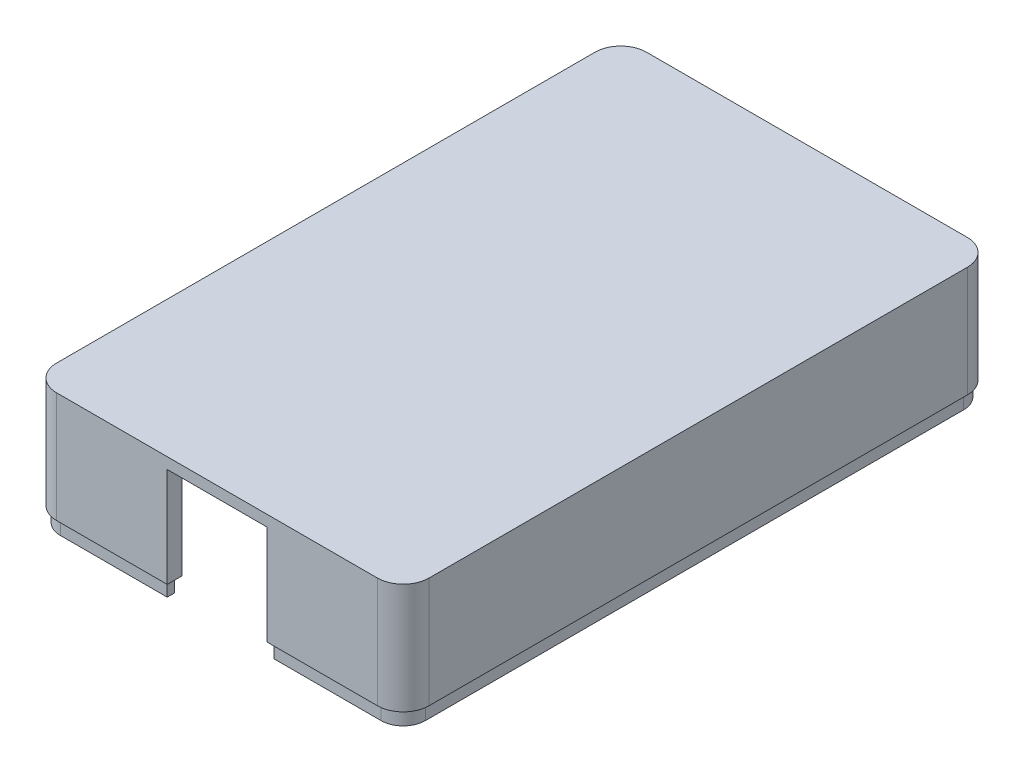
from build123d import *

# Parameters (mm, degrees)
BOSS_EXTRUDE1_DEPTH     = 15
CUT_EXTRUDE1_DEPTH      = 13.5
SKETCH3_W               = 13.5
SKETCH3_H               = 27
CUT_EXTRUDE2_DEPTH      = 15
SALIENTE_EXTRUIR1_DEPTH = 2


with BuildPart() as part:
    # Sketch1 → Boss-Extrude1 (new body)
    with BuildSketch(Plane(origin=(0, 0, 0), x_dir=(1, 0, 0), z_dir=(0, 1, 0))):
        with BuildLine():
            Line((-21.75, -40), (21.75, -40))
            ThreePointArc((21.75, -40), (24.224873734, -38.974873734), (25.25, -36.5))
            Line((25.25, -36.5), (25.25, 36.5))
            ThreePointArc((25.25, 36.5), (24.224873734, 38.974873734), (21.75, 40))
            Line((21.75, 40), (-21.75, 40))
            ThreePointArc((-21.75, 40), (-24.224873734, 38.974873734), (-25.25, 36.5))
            Line((-25.25, 36.5), (-25.25, -36.5))
            ThreePointArc((-25.25, -36.5), (-24.224873734, -38.974873734), (-21.75, -40))
        make_face()
    extrude(amount=BOSS_EXTRUDE1_DEPTH)

    # Sketch2 → Cut-Extrude1 (cut)
    with BuildSketch(Plane.XZ):
        with BuildLine():
            Line((-19.75, -38), (19.75, -38))
            ThreePointArc((19.75, -38), (22.224873734, -36.974873734), (23.25, -34.5))
            Line((23.25, -34.5), (23.25, 34.5))
            ThreePointArc((23.25, 34.5), (22.224873734, 36.974873734), (19.75, 38))
            Line((19.75, 38), (-19.75, 38))
            ThreePointArc((-19.75, 38), (-22.224873734, 36.974873734), (-23.25, 34.5))
            Line((-23.25, 34.5), (-23.25, -34.5))
            ThreePointArc((-23.25, -34.5), (-22.224873734, -36.974873734), (-19.75, -38))
        make_face()
    extrude(amount=-CUT_EXTRUDE1_DEPTH, mode=Mode.SUBTRACT)

    # Sketch3 → Cut-Extrude2 (cut)
    with BuildSketch(Plane.XY.offset(40)):
        Rectangle(SKETCH3_W, SKETCH3_H)
    extrude(amount=-CUT_EXTRUDE2_DEPTH, mode=Mode.SUBTRACT)

    # Croquis3 → Saliente-Extruir1 (add)
    with BuildSketch(Plane.XZ):
        with BuildLine():
            Line((7.25, 38.5), (19.75, 38.5))
            ThreePointArc((19.75, 38.5), (22.578427125, 37.328427125), (23.75, 34.5))
            Line((23.75, 34.5), (23.75, -34.5))
            ThreePointArc((23.75, -34.5), (22.578427125, -37.328427125), (19.75, -38.5))
            Line((19.75, -38.5), (-19.75, -38.5))
            ThreePointArc((-19.75, -38.5), (-22.578427125, -37.328427125), (-23.75, -34.5))
            Line((-23.75, -34.5), (-23.75, 34.5))
            ThreePointArc((-23.75, 34.5), (-22.578427125, 37.328427125), (-19.75, 38.5))
            Line((-19.75, 38.5), (-7.25, 38.5))
            Line((-7.25, 38.5), (-7.25, 39.5))
            Line((-7.25, 39.5), (-21.75, 39.5))
            ThreePointArc((-21.75, 39.5), (-23.871320344, 38.621320344), (-24.75, 36.5))
            Line((-24.75, 36.5), (-24.75, -36.5))
            ThreePointArc((-24.75, -36.5), (-23.871320344, -38.621320344), (-21.75, -39.5))
            Line((-21.75, -39.5), (21.75, -39.5))
            ThreePointArc((21.75, -39.5), (23.871320344, -38.621320344), (24.75, -36.5))
            Line((24.75, -36.5), (24.75, 36.5))
            ThreePointArc((24.75, 36.5), (23.871320344, 38.621320344), (21.75, 39.5))
            Line((21.75, 39.5), (7.25, 39.5))
            Line((7.25, 39.5), (7.25, 38.5))
        make_face()
    extrude(amount=SALIENTE_EXTRUIR1_DEPTH)


solid = part.part
